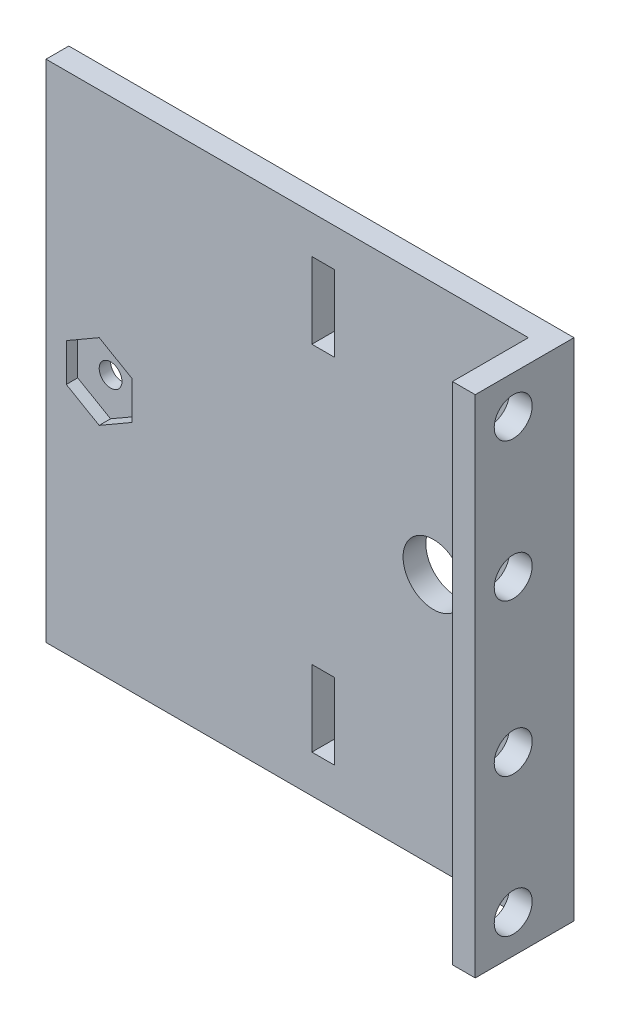
from build123d import *

# Parameters (mm, degrees)
SKETCH1_W           = 66.5
SKETCH1_H           = 66.5
SKETCH1_R           = 4
BOSS_EXTRUDE1_DEPTH = 3
SKETCH3_W           = 3
SKETCH3_H           = 66.5
BOSS_EXTRUDE2_DEPTH = 10
CUT_EXTRUDE1_REACH  = 77.477
SKETCH5_R           = 2.5
CUT_EXTRUDE2_REACH  = 50.787
SKETCH6_W           = 3
SKETCH6_H           = 10
CUT_EXTRUDE5_DEPTH  = 1.5
CUT_EXTRUDE6_REACH  = 50.787
SKETCH9_R           = 1.5


with BuildPart() as part:
    # Sketch1 → Boss-Extrude1 (new body)
    with BuildSketch(Plane.XY):
        Rectangle(SKETCH1_W, SKETCH1_H)
        with Locations((17.75, 0)):
            Circle(SKETCH1_R, mode=Mode.SUBTRACT)
    extrude(amount=BOSS_EXTRUDE1_DEPTH)

    # Sketch3 → Boss-Extrude2 (add)
    with BuildSketch(Plane.XY.offset(3)):
        with Locations((31.75, 0)):
            Rectangle(SKETCH3_W, SKETCH3_H)
    extrude(amount=BOSS_EXTRUDE2_DEPTH)

    # Sketch5 → Cut-Extrude1 (cut, up to next)
    with BuildSketch(Plane(origin=(33.25, 0, 0), x_dir=(0, 0, -1), z_dir=(1, 0, 0)), mode=Mode.PRIVATE) as cut_extrude1_sk1:
        with Locations((-8, -28.25)):
            Circle(SKETCH5_R)
    cut_extrude1_tool1 = extrude(cut_extrude1_sk1.sketch, amount=-CUT_EXTRUDE1_REACH, mode=Mode.PRIVATE) & part.part
    # Sketch5 → Cut-Extrude1 (cut, up to next)
    with BuildSketch(Plane(origin=(33.25, 0, 0), x_dir=(0, 0, -1), z_dir=(1, 0, 0)), mode=Mode.PRIVATE) as cut_extrude1_sk2:
        with Locations((-8, -10)):
            Circle(SKETCH5_R)
    cut_extrude1_tool2 = extrude(cut_extrude1_sk2.sketch, amount=-CUT_EXTRUDE1_REACH, mode=Mode.PRIVATE) & part.part
    cut_extrude1_1 = cut_extrude1_tool1.solids().sort_by_distance((33.25, -28.25, 8))[0]
    add(cut_extrude1_1, mode=Mode.SUBTRACT)
    cut_extrude1_2 = cut_extrude1_tool2.solids().sort_by_distance((33.25, -10, 8))[0]
    add(cut_extrude1_2, mode=Mode.SUBTRACT)
    cut_extrude1 = cut_extrude1_1 + cut_extrude1_2  # Cut-Extrude1 as one shape, for the pattern or mirror that repeats it

    # Mirror2: Cut-Extrude1 across plane
    add(cut_extrude1.mirror(Plane.ZX), mode=Mode.SUBTRACT)

    # Sketch6 → Cut-Extrude2 (cut, up to next)
    with BuildSketch(Plane(origin=(0, 0, 0), x_dir=(-1, 0, 0), z_dir=(0, 0, -1)), mode=Mode.PRIVATE) as cut_extrude2_sk1:
        with Locations((-3.25, 23.25)):
            Rectangle(SKETCH6_W, SKETCH6_H)
    cut_extrude2_tool1 = extrude(cut_extrude2_sk1.sketch, amount=-CUT_EXTRUDE2_REACH, mode=Mode.PRIVATE) & part.part
    cut_extrude2 = cut_extrude2_tool1.solids().sort_by_distance((3.25, 23.25, 0))[0]
    add(cut_extrude2, mode=Mode.SUBTRACT)

    # Mirror3: Cut-Extrude2 across plane
    add(cut_extrude2.mirror(Plane.ZX), mode=Mode.SUBTRACT)

    # Sketch7 → Cut-Extrude5 (cut)
    with BuildSketch(Plane(origin=(0, 0, 3), x_dir=(-1, 0, 0), z_dir=(0, 0, -1))):
        Polygon((26.25, -5), (30.580127019, -2.5), (30.580127019, 2.5), (26.25, 5), (21.919872981, 2.5), (21.919872981, -2.5), align=None)
    extrude(amount=CUT_EXTRUDE5_DEPTH, mode=Mode.SUBTRACT)

    # Sketch9 → Cut-Extrude6 (cut, up to next)
    with BuildSketch(Plane(origin=(0, 0, 0), x_dir=(-1, 0, 0), z_dir=(0, 0, -1)), mode=Mode.PRIVATE) as cut_extrude6_sk1:
        with Locations((26.25, 0)):
            Circle(SKETCH9_R)
    cut_extrude6_tool1 = extrude(cut_extrude6_sk1.sketch, amount=-CUT_EXTRUDE6_REACH, mode=Mode.PRIVATE) & part.part
    add(cut_extrude6_tool1.solids().sort_by_distance((-26.25, 0, 0))[0], mode=Mode.SUBTRACT)


solid = part.part
